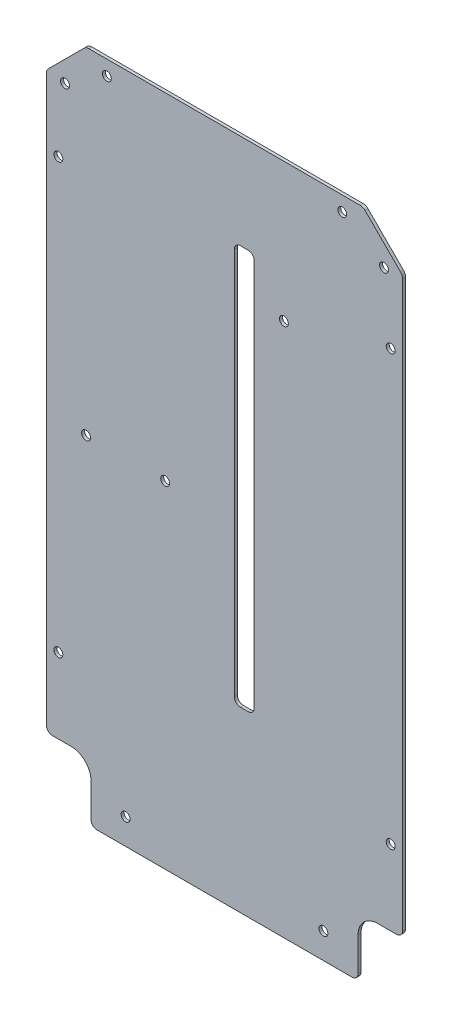
from build123d import *

# Parameters (mm, degrees)
ESQUISSE1_W                  = 180
ESQUISSE1_H                  = 340
BOSS_EXTRU_1_DEPTH           = 1.5
ENL_V_MAT_EXTRU_1_DEPTH      = 385.710605521
ENL_V_MAT_EXTRU_1_DEPTH_BACK = 385.710605521
ESQUISSE2_R                  = 2.25
ENL_V_MAT_EXTRU_2_DEPTH      = 385.710605521
ENL_V_MAT_EXTRU_2_DEPTH_BACK = 385.710605521
ESQUISSE3_W                  = 22.5
ESQUISSE3_H                  = 30
CONG_1_R                     = 10
CONG_2_R                     = 3
ENL_V_MAT_EXTRU_3_DEPTH      = 385.710605521
ENL_V_MAT_EXTRU_3_DEPTH_BACK = 385.710605521
ESQUISSE4_W                  = 10
ESQUISSE4_H                  = 202
CONG_3_R                     = 3
CHANFREIN1_SIZE              = 20
CHANFREIN2_SIZE              = 20
ESQUISSE5_R                  = 2.25
ENL_V_MAT_EXTRU_4_DEPTH      = 385.710605521
ENL_V_MAT_EXTRU_5_DEPTH      = 385.710605521
ENL_V_MAT_EXTRU_5_DEPTH_BACK = 385.710605521
ESQUISSE6_R                  = 2.25
CONG_4_R                     = 3.5


with BuildPart() as part:
    # Esquisse1 → Boss.-Extru.1 (new body)
    with BuildSketch(Plane.XY):
        with Locations((90, 170)):
            Rectangle(ESQUISSE1_W, ESQUISSE1_H)
    extrude(amount=BOSS_EXTRU_1_DEPTH)

    # Esquisse2 → Enlèv. mat.-Extru.1 (cut, two sides: drawn at the far end of the back side and taken through both)
    with BuildSketch(Plane.XY.offset(1.5).offset(-ENL_V_MAT_EXTRU_1_DEPTH_BACK)):
        with Locations((40, 13)):
            Circle(ESQUISSE2_R)
        with Locations((140, 13)):
            Circle(ESQUISSE2_R)
    extrude(amount=ENL_V_MAT_EXTRU_1_DEPTH + ENL_V_MAT_EXTRU_1_DEPTH_BACK, mode=Mode.SUBTRACT)

    # Esquisse3 → Enlèv. mat.-Extru.2 (cut, two sides: drawn at the far end of the back side and taken through both)
    with BuildSketch(Plane.XY.offset(1.5).offset(-ENL_V_MAT_EXTRU_2_DEPTH_BACK)):
        with Locations((11.25, 15)):
            Rectangle(ESQUISSE3_W, ESQUISSE3_H)
        with Locations((168.75, 15)):
            Rectangle(ESQUISSE3_W, ESQUISSE3_H)
    extrude(amount=ENL_V_MAT_EXTRU_2_DEPTH + ENL_V_MAT_EXTRU_2_DEPTH_BACK, mode=Mode.SUBTRACT)

    # Congé1
    cong_1_edges = [part.edges().sort_by_distance(p)[0] for p in [
        (157.5, 30, 0.75),
        (22.5, 30, 0.75),
    ]]
    fillet(cong_1_edges, radius=CONG_1_R)

    # Congé2
    cong_2_edges = [part.edges().sort_by_distance(p)[0] for p in [
        (0, 30, 0.75),
        (22.5, 0, 0.75),
        (180, 30, 0.75),
        (157.5, 0, 0.75),
    ]]
    fillet(cong_2_edges, radius=CONG_2_R)

    # Esquisse4 → Enlèv. mat.-Extru.3 (cut, two sides: drawn at the far end of the back side and taken through both)
    with BuildSketch(Plane.XY.offset(1.5).offset(-ENL_V_MAT_EXTRU_3_DEPTH_BACK)):
        with Locations((100, 191)):
            Rectangle(ESQUISSE4_W, ESQUISSE4_H)
    extrude(amount=ENL_V_MAT_EXTRU_3_DEPTH + ENL_V_MAT_EXTRU_3_DEPTH_BACK, mode=Mode.SUBTRACT)

    # Congé3
    cong_3_edges = [part.edges().sort_by_distance(p)[0] for p in [
        (95, 292, 0.75),
        (105, 292, 0.75),
        (105, 90, 0.75),
        (95, 90, 0.75),
    ]]
    fillet(cong_3_edges, radius=CONG_3_R)

    # Chanfrein1
    chanfrein1_edges = [part.edges().sort_by_distance(p)[0] for p in [
        (180, 340, 0.75),
    ]]
    chamfer(chanfrein1_edges, length=CHANFREIN1_SIZE)

    # Chanfrein2
    chanfrein2_edges = [part.edges().sort_by_distance(p)[0] for p in [
        (0, 340, 0.75),
    ]]
    chamfer(chanfrein2_edges, length=CHANFREIN2_SIZE)

    # Esquisse5 → Enlèv. mat.-Extru.4 (cut, through all)
    with BuildSketch(Plane.XY.offset(1.5)):
        with Locations((120, 270)):
            Circle(ESQUISSE5_R)
    extrude(amount=-ENL_V_MAT_EXTRU_4_DEPTH, mode=Mode.SUBTRACT)

    # Esquisse6 → Enlèv. mat.-Extru.5 (cut, two sides: drawn at the far end of the back side and taken through both)
    with BuildSketch(Plane.XY.offset(1.5).offset(-ENL_V_MAT_EXTRU_5_DEPTH_BACK)):
        with Locations((6, 285)):
            Circle(ESQUISSE6_R)
        with Locations((6, 68)):
            Circle(ESQUISSE6_R)
        with Locations((174, 68)):
            Circle(ESQUISSE6_R)
        with Locations((174, 285)):
            Circle(ESQUISSE6_R)
        with Locations((20, 170)):
            Circle(ESQUISSE6_R)
        with Locations((60, 170)):
            Circle(ESQUISSE6_R)
        with Locations((149.5, 332.5)):
            Circle(ESQUISSE6_R)
        with Locations((170.630835149, 318.762563133)):
            Circle(ESQUISSE6_R)
        with Locations((9.369164851, 318.762563133)):
            Circle(ESQUISSE6_R)
        with Locations((30.5, 332.5)):
            Circle(ESQUISSE6_R)
    extrude(amount=ENL_V_MAT_EXTRU_5_DEPTH + ENL_V_MAT_EXTRU_5_DEPTH_BACK, mode=Mode.SUBTRACT)

    # Congé4
    cong_4_edges = [part.edges().sort_by_distance(p)[0] for p in [
        (180, 320, 0.75),
        (160, 340, 0.75),
        (20, 340, 0.75),
        (0, 320, 0.75),
    ]]
    fillet(cong_4_edges, radius=CONG_4_R)


solid = part.part
